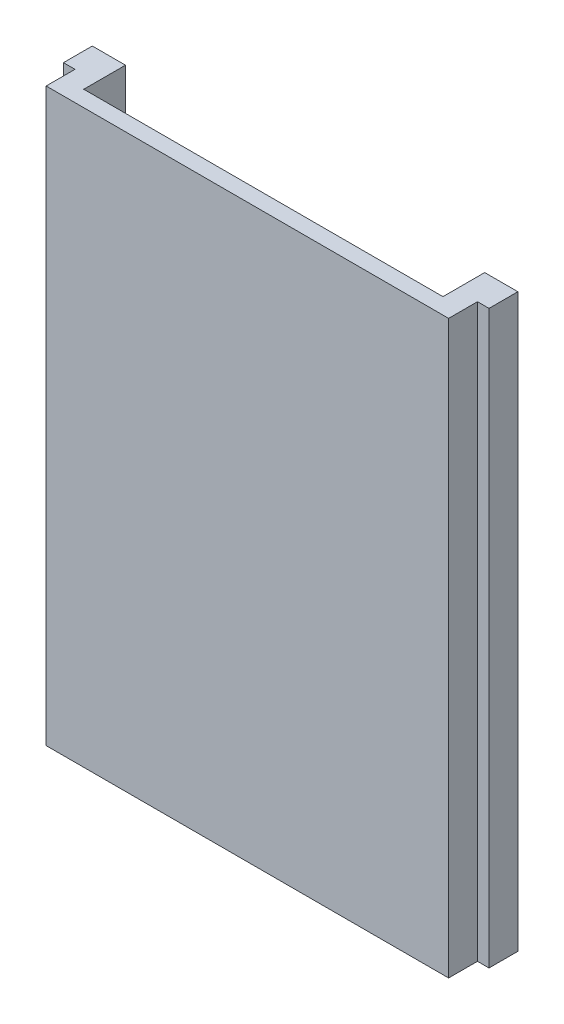
from build123d import *

# Parameters (mm, degrees)
SALIENTE_EXTRUIR4_DEPTH = 198


with BuildPart() as part:
    # Croquis1 → Saliente-Extruir4 (new body)
    with BuildSketch(Plane(origin=(0, 0, 0), x_dir=(1, 0, 0), z_dir=(0, 1, 0))):
        Polygon((-4, 10), (-4, 20), (7.5, 20), (7.5, 5.536148668), (132, 5.536148668), (132, 20), (143.5, 20), (143.5, 10), (139.5, 10), (139.5, 0), (0, 0), (0, 10), align=None)
    extrude(amount=SALIENTE_EXTRUIR4_DEPTH)


solid = part.part
